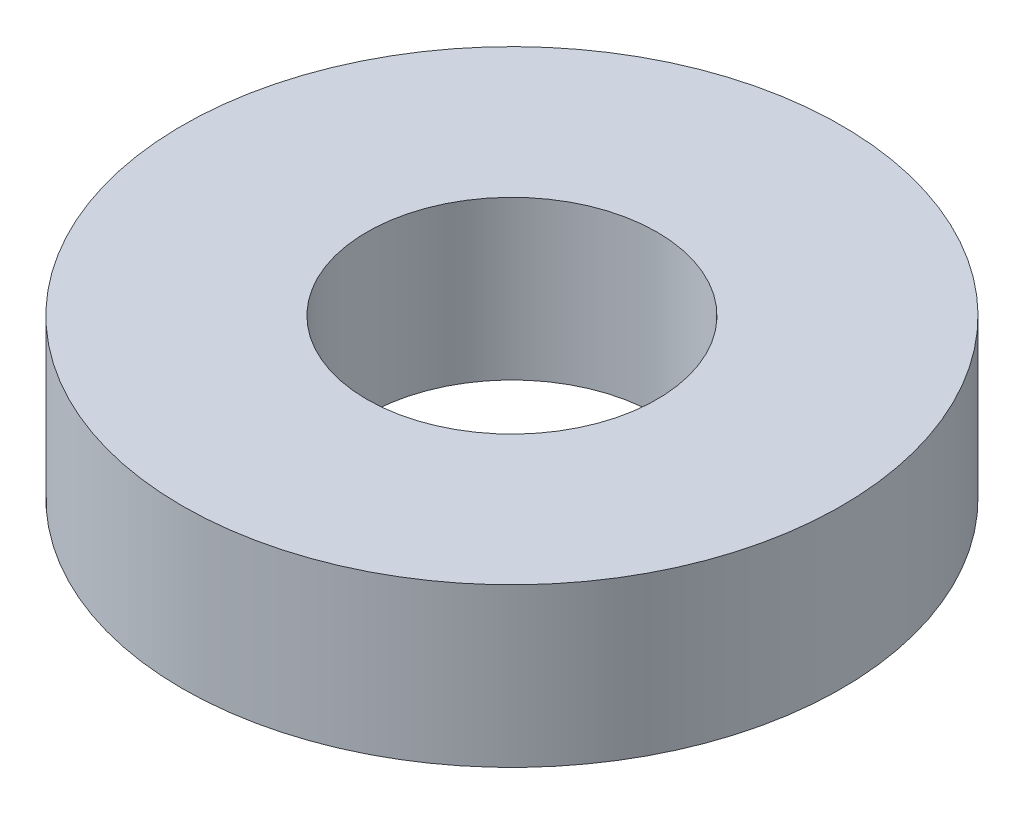
from build123d import *

# Parameters (mm, degrees)
SKETCH1_R           = 62.5
BOSS_EXTRUDE1_DEPTH = 30
SKETCH2_R           = 27.5
CUT_EXTRUDE1_DEPTH  = 94.340773513


with BuildPart() as part:
    # Sketch1 → Boss-Extrude1 (new body)
    with BuildSketch(Plane(origin=(0, 0, 0), x_dir=(1, 0, 0), z_dir=(0, 1, 0))):
        Circle(SKETCH1_R)
    extrude(amount=BOSS_EXTRUDE1_DEPTH)

    # Sketch2 → Cut-Extrude1 (cut, through all)
    with BuildSketch(Plane(origin=(0, 0, 0), x_dir=(1, 0, 0), z_dir=(0, 1, 0))):
        Circle(SKETCH2_R)
    extrude(amount=CUT_EXTRUDE1_DEPTH, mode=Mode.SUBTRACT)


solid = part.part
